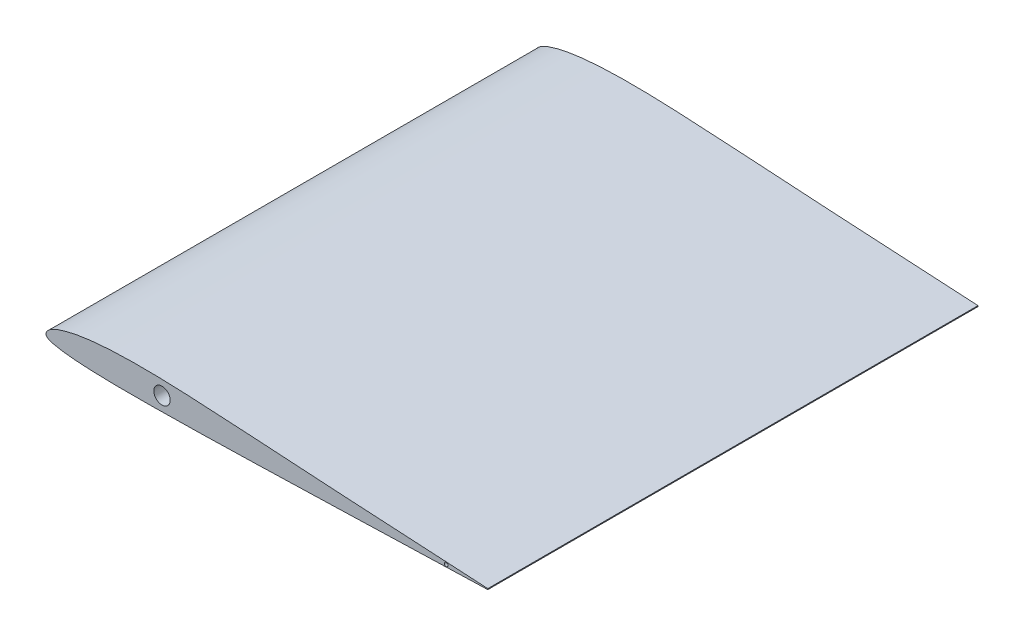
from build123d import *

# Parameters (mm, degrees)
AIRFOIL_DEPTH        = 225.425
CAMERA_CHANNEL_REACH = 305.62
SKETCH8_R            = 3.7592
SKETCH9_R            = 0.8636
CUT_EXTRUDE1_DEPTH   = 304.620080002


with BuildPart() as part:
    # Sketch3 → Airfoil (new body)
    with BuildSketch(Plane.XY):
        with BuildLine():
            Line((203.2026416, 0.2115312), (203.1973584, -0.2115312))
            add(Edge.make_bspline(
                [(203.2026416, 0.2115312), (202.749975414, 0.235767735), (201.482227455, 0.303645165), (199.229899451, 0.427581862), (196.304631843, 0.58645357), (192.978703522, 0.769351745), (189.375038631, 0.970599063), (185.612938037, 1.178498421), (181.773697727, 1.395742795), (177.899622281, 1.614727685), (174.009999544, 1.835420869), (170.113241345, 2.055248875), (166.213278896, 2.277505712), (162.311711246, 2.498550948), (158.410741475, 2.722039599), (154.51059314, 2.944050358), (150.614228349, 3.167765812), (146.720449867, 3.393606246), (142.830938385, 3.617021658), (138.944036437, 3.845362214), (135.059465523, 4.072120956), (131.177542014, 4.301224247), (127.296716125, 4.531457234), (123.418858544, 4.764935655), (119.542057199, 5.000803845), (115.667451592, 5.239845443), (111.794903734, 5.481590715), (107.92356364, 5.724700666), (104.057153857, 5.968055719), (100.189436188, 6.212019472), (96.318759225, 6.454299415), (92.447746967, 6.694605077), (88.584023823, 6.932155402), (84.741460885, 7.163725688), (80.922901098, 7.388921542), (77.397782248, 7.59058238), (74.522903974, 7.749287039), (71.994617804, 7.884276403), (69.124106699, 8.032386004), (65.508268577, 8.20759336), (61.485211762, 8.383132514), (57.521769068, 8.532806767), (53.67337931, 8.65196061), (49.905829014, 8.739019457), (46.180960609, 8.791245505), (42.490964532, 8.80473096), (38.846800487, 8.774220372), (35.259629974, 8.696203332), (31.756076473, 8.567101257), (28.366063073, 8.385637047), (25.12916512, 8.151985933), (22.079780002, 7.868751339), (19.258728777, 7.54280933), (16.701884478, 7.183689544), (14.433629815, 6.805801873), (12.454092042, 6.421559693), (10.747122797, 6.041820295), (9.282979556, 5.674052725), (8.026380981, 5.32164067), (6.939364861, 4.984377042), (5.987597489, 4.659887308), (5.142872565, 4.34265889), (4.375389754, 4.030109088), (3.657744375, 3.708063164), (2.964607554, 3.360683786), (2.286752141, 2.970800639), (1.638361257, 2.53049627), (1.049962466, 2.035518438), (0.55105342, 1.482304271), (0.182124171, 0.879494893), (0.020226764, 0.365089231), (-0.006478658, -0.019297801), (0.019393578, -0.313623078), (0.126773921, -0.614429835), (0.296985654, -0.854594391), (0.474203046, -1.0360418), (0.692231827, -1.205448428), (0.984641636, -1.3848123), (1.352473451, -1.566840486), (1.779379473, -1.744801104), (2.260500407, -1.917169047), (2.806664849, -2.087583046), (3.441332814, -2.260164552), (4.188115361, -2.438004982), (5.06690206, -2.621532136), (6.092157789, -2.806861911), (7.276571085, -2.993059902), (8.634334508, -3.178000051), (10.186878433, -3.35940408), (11.960820402, -3.536894099), (13.988248891, -3.707664418), (16.294928682, -3.868904436), (18.89372996, -4.015528606), (21.766154486, -4.143679461), (24.87293007, -4.249244795), (28.158435839, -4.329742718), (31.577459925, -4.386681674), (35.091351007, -4.420650673), (38.679106505, -4.435118029), (42.321638443, -4.431127332), (46.012586406, -4.412453932), (49.757901166, -4.379533307), (53.580508995, -4.337179517), (57.514943683, -4.284200631), (61.595949927, -4.220224301), (65.884086903, -4.144461591), (69.583989281, -4.072095586), (72.808820505, -4.005043155), (75.579862857, -3.944754288), (78.770794894, -3.87272284), (82.213745044, -3.790898591), (85.812278509, -3.702057045), (89.454775682, -3.609141494), (93.150227317, -3.511616573), (96.888909494, -3.411069637), (100.657029944, -3.306886052), (104.439744756, -3.201756582), (108.224810971, -3.094514402), (112.008194618, -2.986301144), (115.791031649, -2.876635979), (119.578217649, -2.765818396), (123.376483987, -2.65229883), (127.194486092, -2.537598816), (131.04164704, -2.420012089), (134.919802339, -2.301989441), (138.81936176, -2.182338271), (142.726333168, -2.060156236), (146.633431624, -1.937306429), (150.540542811, -1.8169006), (154.447614149, -1.693516374), (158.354722861, -1.573509134), (162.26148206, -1.451514239), (166.167503923, -1.331681527), (170.071797885, -1.208888837), (173.972889131, -1.08970993), (177.866894682, -0.967751167), (181.74532249, -0.848820183), (185.588910116, -0.731171396), (189.354936457, -0.616949477), (192.962622684, -0.509627047), (196.29203641, -0.412964276), (199.220341745, -0.324818889), (201.475188064, -0.261715668), (202.74429193, -0.224733669), (203.1973584, -0.2115312)],
                knots=[0, 0, 0, 0, 0.003315783, 0.009286262, 0.01649964, 0.024744274, 0.033650618, 0.042899826, 0.052304254, 0.061777775, 0.071282103, 0.080800776, 0.090326048, 0.099854782, 0.109384674, 0.118906596, 0.128428716, 0.137931689, 0.147435622, 0.156925556, 0.166411563, 0.175897802, 0.185369409, 0.194847889, 0.20431387, 0.213778822, 0.22324269, 0.232694875, 0.242151635, 0.251579623, 0.261041636, 0.270519226, 0.279948764, 0.289356316, 0.298676754, 0.307928254, 0.315183044, 0.31973714, 0.326447814, 0.336207398, 0.346216249, 0.35590244, 0.365218591, 0.374378655, 0.38346733, 0.392466507, 0.40136886, 0.410122896, 0.418710299, 0.427012022, 0.434953476, 0.442446764, 0.449411134, 0.455723479, 0.461330459, 0.466229103, 0.470471324, 0.474119786, 0.477269946, 0.48001617, 0.482443707, 0.48462406, 0.486615379, 0.48850422, 0.490376245, 0.492284157, 0.494220159, 0.496101738, 0.49789553, 0.499645689, 0.501236957, 0.501776184, 0.502456996, 0.50338555, 0.504071488, 0.504595279, 0.505236101, 0.506085552, 0.507100329, 0.508234964, 0.509466926, 0.51083723, 0.512418824, 0.514276846, 0.516451552, 0.518984588, 0.521896832, 0.525220723, 0.529007031, 0.533329617, 0.538260507, 0.543888673, 0.550242528, 0.557299236, 0.564919576, 0.572979857, 0.581338081, 0.589931372, 0.59868335, 0.607580916, 0.616574706, 0.62568118, 0.63497715, 0.644536982, 0.654462302, 0.664831439, 0.675907565, 0.68153051, 0.688424661, 0.696181232, 0.704876621, 0.713615329, 0.722510831, 0.73152844, 0.74065523, 0.749867421, 0.759101002, 0.768334695, 0.777564511, 0.786785993, 0.796015995, 0.805277853, 0.814580932, 0.823955486, 0.833431168, 0.842960949, 0.852492353, 0.862022798, 0.871553661, 0.881084601, 0.890615434, 0.900145802, 0.909674638, 0.919199589, 0.928717996, 0.938222598, 0.947696375, 0.957100207, 0.966349803, 0.975255754, 0.983500408, 0.990713161, 0.996684625, 1, 1, 1, 1], degree=3))
        make_face()
    extrude(amount=AIRFOIL_DEPTH)

    # Sketch8 → Camera Channel (cut, up to next)
    with BuildSketch(Plane(origin=(0, 0, 0), x_dir=(-1, 0, 0), z_dir=(0, 0, -1)), mode=Mode.PRIVATE) as camera_channel_sk1:
        with Locations((-53.339999981, 2.15866289)):
            Circle(SKETCH8_R)
    camera_channel_tool1 = extrude(camera_channel_sk1.sketch, amount=-CAMERA_CHANNEL_REACH, mode=Mode.PRIVATE) & part.part
    add(camera_channel_tool1.solids().sort_by_distance((53.34, 2.158663, 0))[0], mode=Mode.SUBTRACT)

    # Sketch9 → Cut-Extrude1 (cut, through all)
    with BuildSketch(Plane(origin=(0, 0, 0), x_dir=(-1, 0, 0), z_dir=(0, 0, -1))):
        with Locations((-184.0510416, 0.244383133)):
            Circle(SKETCH9_R)
    extrude(amount=-CUT_EXTRUDE1_DEPTH, mode=Mode.SUBTRACT)


solid = part.part
